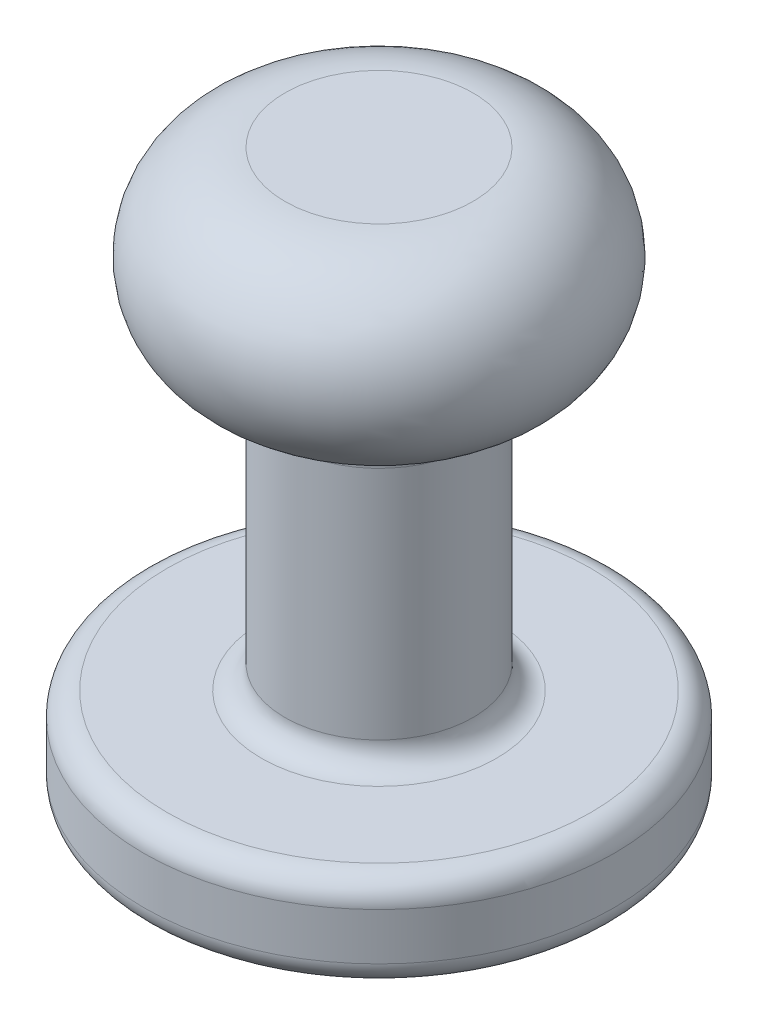
from build123d import *


with BuildPart() as part:
    # Sketch2 → Joystick (revolve)
    with BuildSketch(Plane.XY):
        with BuildLine():
            Line((0, -2), (4.5, -2))
            ThreePointArc((4.5, -2), (4.853553391, -1.853553391), (5, -1.5))
            Line((5, -1.5), (5, -0.5))
            ThreePointArc((5, -0.5), (4.853553391, -0.146446609), (4.5, 0))
            Line((4.5, 0), (2.5, 0))
            ThreePointArc((2.5, 0), (2.146446609, 0.146446609), (2, 0.5))
            Line((2, 0.5), (2, 5.5))
            ThreePointArc((2, 5.5), (2.146446609, 5.853553391), (2.5, 6))
            Line((2.5, 6), (2, 6))
            ThreePointArc((2, 6), (4, 8), (2, 10))
            Line((2, 10), (0, 10))
            Line((0, 10), (0, -2))
        make_face()
    revolve(axis=Axis((0, 14.75249226, 0), (0, -1, 0)))


solid = part.part
